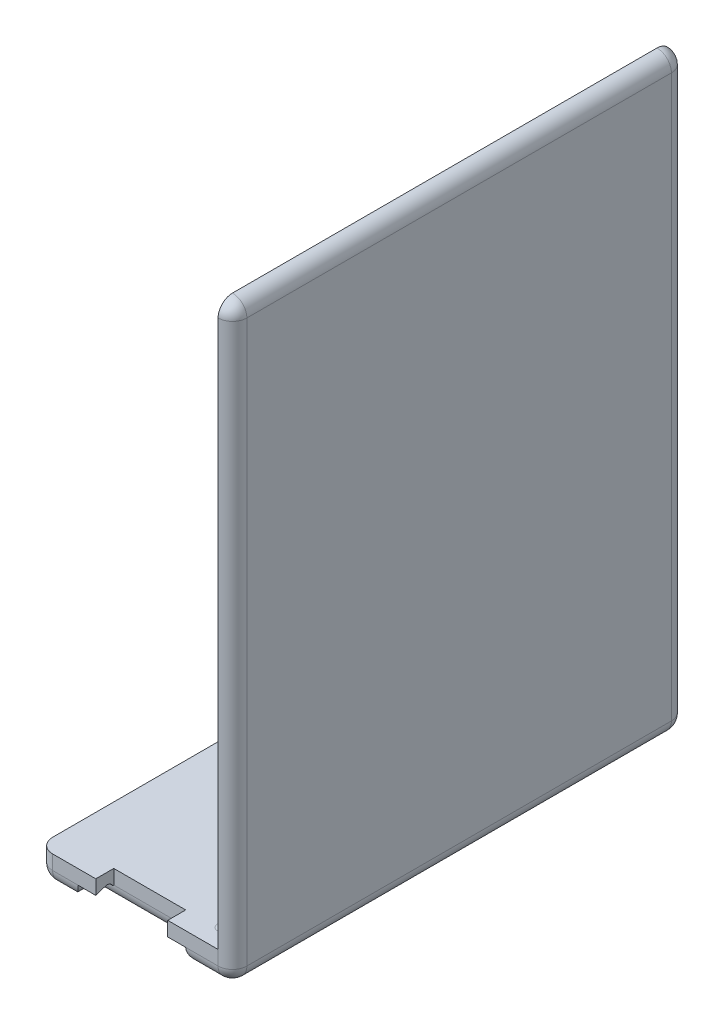
from build123d import *

# Parameters (mm, degrees)
SKETCH1_W           = 25
SKETCH1_H           = 63
BOSS_EXTRUDE1_DEPTH = 4
SKETCH3_W           = 63
SKETCH3_H           = 4
BOSS_EXTRUDE2_DEPTH = 2
SKETCH4_W           = 2
SKETCH4_H           = 63
BOSS_EXTRUDE3_DEPTH = 78
SKETCH6_W           = 10
SKETCH6_H           = 2.5
CUT_EXTRUDE1_DEPTH  = 107.386089316
SKETCH6_3_W         = 10
SKETCH6_3_H         = 2.5
CUT_EXTRUDE2_DEPTH  = 80
SKETCH8_W           = 15
SKETCH8_H           = 2
CUT_EXTRUDE3_DEPTH  = 2.5
CUT_EXTRUDE5_DEPTH  = 15
SKETCH11_W          = 15
SKETCH11_H          = 2
CUT_EXTRUDE6_DEPTH  = 3
CUT_EXTRUDE7_DEPTH  = 15
FILLET6_R           = 2
FILLET7_R           = 2
BOSS_EXTRUDE4_DEPTH = 70
FILLET8_R           = 0.4
FILLET9_R           = 2
CUT_EXTRUDE8_DEPTH  = 2


# Some blends are built 0.0001 mm under size
with BuildPart() as part:
    # Sketch1 → Boss-Extrude1 (new body)
    with BuildSketch(Plane(origin=(0, 0, 0), x_dir=(1, 0, 0), z_dir=(0, 1, 0))):
        with Locations((-12.5, -31.5)):
            Rectangle(SKETCH1_W, SKETCH1_H)
    extrude(amount=BOSS_EXTRUDE1_DEPTH)

    # Sketch3 → Boss-Extrude2 (add)
    with BuildSketch(Plane(origin=(0, 0, 0), x_dir=(0, 0, -1), z_dir=(1, 0, 0))):
        with Locations((-31.5, 2)):
            Rectangle(SKETCH3_W, SKETCH3_H)
    extrude(amount=BOSS_EXTRUDE2_DEPTH)

    # Sketch4 → Boss-Extrude3 (add)
    with BuildSketch(Plane(origin=(0, 4, 0), x_dir=(1, 0, 0), z_dir=(0, 1, 0))):
        with Locations((1, -31.5)):
            Rectangle(SKETCH4_W, SKETCH4_H)
    extrude(amount=BOSS_EXTRUDE3_DEPTH)

    # Sketch6 → Cut-Extrude1 (cut, through all)
    with BuildSketch(Plane.XZ):
        with Locations((-12, 1.25)):
            Rectangle(SKETCH6_W, SKETCH6_H)
    extrude(amount=-CUT_EXTRUDE1_DEPTH, mode=Mode.SUBTRACT)

    # Sketch6<3> → Cut-Extrude2 (cut)
    with BuildSketch(Plane.XZ):
        with Locations((-12, 61.75)):
            Rectangle(SKETCH6_3_W, SKETCH6_3_H)
    extrude(amount=-CUT_EXTRUDE2_DEPTH, mode=Mode.SUBTRACT)

    # Sketch8 → Cut-Extrude3 (cut)
    with BuildSketch(Plane.XY.offset(63)):
        with Locations((-12, 1)):
            Rectangle(SKETCH8_W, SKETCH8_H)
    extrude(amount=-CUT_EXTRUDE3_DEPTH, mode=Mode.SUBTRACT)

    # Sketch9 → Cut-Extrude5 (cut)
    with BuildSketch(Plane.ZY.offset(4.5)):
        with BuildLine():
            ThreePointArc((61.5, 2.5), (61, 2.366025404), (60.633974596, 2))
            Line((60.633974596, 2), (63, 2))
            Line((63, 2), (61.5, 2.5))
        make_face()
    extrude(amount=CUT_EXTRUDE5_DEPTH, mode=Mode.SUBTRACT)

    # Sketch11 → Cut-Extrude6 (cut)
    with BuildSketch(Plane(origin=(0, 0, 0), x_dir=(-1, 0, 0), z_dir=(0, 0, -1))):
        with Locations((12, 1)):
            Rectangle(SKETCH11_W, SKETCH11_H)
    extrude(amount=-CUT_EXTRUDE6_DEPTH, mode=Mode.SUBTRACT)

    # Sketch12 → Cut-Extrude7 (cut)
    with BuildSketch(Plane.ZY.offset(4.5)):
        with BuildLine():
            ThreePointArc((2.766025404, 2), (2.4, 2.366025404), (1.9, 2.5))
            Line((1.9, 2.5), (0, 2))
            Line((0, 2), (2.766025404, 2))
        make_face()
    extrude(amount=CUT_EXTRUDE7_DEPTH, mode=Mode.SUBTRACT)

    # Fillet6
    fillet6_edges = [part.edges().sort_by_distance(p)[0] for p in [
        (-19.5, 0, 1.5),
        (-22.25, 0, 0),
        (-25, 0, 31.5),
        (-22.25, 0, 63),
        (-19.5, 0, 61.75),
        (-12, 0, 60.5),
        (-4.5, 0, 61.75),
        (-1.25, 0, 63),
        (2, 0, 31.5),
        (-1.25, 0, 0),
        (-4.5, 0, 1.5),
        (-12, 0, 3),
    ]]
    fillet(fillet6_edges, radius=FILLET6_R - 0.0001)  # a hair under: the kernel refuses the full size

    # Fillet7
    # the kernel refuses this fillet: 2 mm, written as the material it takes off along each edge
    with BuildSketch(Plane(origin=(-23, 0, 61), x_dir=(0, 0, 1), z_dir=(1, 0, 0))) as fillet7_piece_1:
        with BuildLine():
            CenterArc((0.0001, -1.9999), 1.9999, 0, 90)
            Line((2, -1.9999), (2, 0))
            Line((2, 0), (0.0001, 0))
        make_face()
    revolve(axis=Axis((-23, 0, 61), (0, -1, 0)), revolution_arc=90, mode=Mode.SUBTRACT)
    with BuildSketch(Plane(origin=(-23, 0, 2), x_dir=(-1, 0, 0), z_dir=(0, 0, 1))) as fillet7_piece_2:
        with BuildLine():
            CenterArc((0.0001, -1.9999), 1.9999, 0, 90)
            Line((2, -1.9999), (2, 0))
            Line((2, 0), (0.0001, 0))
        make_face()
    revolve(axis=Axis((-23, 0, 2), (0, -1, 0)), revolution_arc=90, mode=Mode.SUBTRACT)
    with BuildSketch(Plane(origin=(-25, 0, 63), x_dir=(0, 0, -1), z_dir=(0, 1, 0)), Plane(origin=(-25, 0, 0), x_dir=(1, 0, 0), z_dir=(0, 1, 0))) as fillet7_piece_3:
        with BuildLine():
            CenterArc((FILLET7_R, -FILLET7_R), FILLET7_R, 90, 90)
            Line((0, -FILLET7_R), (0, 0))
            Line((0, 0), (FILLET7_R, 0))
        make_face()
    extrude(amount=9, mode=Mode.SUBTRACT)

    # Sketch13 → Boss-Extrude4 (add)
    with BuildSketch(Plane(origin=(0, 4, 0), x_dir=(1, 0, 0), z_dir=(0, 1, 0))):
        Polygon((0, -4.25), (-1.5, -4.25), (-1.5, -2.6), (-2.7, -2.6), (-2.7, -5.6), (0, -5.6), align=None)
        Polygon((-1.5, -60.4), (-2.7, -60.4), (-2.7, -57.4), (0, -57.4), (0, -58.75), (-1.5, -58.75), align=None)
    extrude(amount=BOSS_EXTRUDE4_DEPTH)

    # Fillet8
    fillet8_edges = [part.edges().sort_by_distance(p)[0] for p in [
        (0, 39, 5.6),
        (-1.5, 4, 3.425),
        (-2.1, 4, 2.6),
        (-1.5, 39, 2.6),
        (-2.7, 4, 4.1),
        (-2.7, 39, 2.6),
        (-1.35, 4, 5.6),
        (-2.7, 39, 5.6),
        (0, 74, 4.925),
        (-2.1, 74, 2.6),
        (-2.7, 74, 4.1),
        (-1.35, 74, 5.6),
        (-1.5, 4, 59.575),
        (-1.5, 39, 60.4),
        (-1.35, 4, 57.4),
        (0, 39, 57.4),
        (-2.7, 4, 58.9),
        (-2.7, 39, 57.4),
        (-2.1, 4, 60.4),
        (-2.7, 39, 60.4),
        (0, 74, 58.075),
        (-1.35, 74, 57.4),
        (-2.7, 74, 58.9),
        (-2.1, 74, 60.4),
    ]]
    fillet(fillet8_edges, radius=FILLET8_R)

    # Fillet9
    # the kernel refuses this fillet: 2 mm, written as the material it takes off along each edge
    with BuildSketch(Plane(origin=(0, 0, 61), x_dir=(1, 0, 0), z_dir=(0, 0, -1))) as fillet9_piece_1:
        with BuildLine():
            CenterArc((0.0001, -1.9999), 1.9999, 0, 90)
            Line((2, -1.9999), (2, 0))
            Line((2, 0), (0.0001, 0))
        make_face()
    revolve(axis=Axis((0, 0, 61), (0, -1, 0)), revolution_arc=90, mode=Mode.SUBTRACT)
    with BuildSketch(Plane(origin=(0, 0, 2), x_dir=(0, 0, -1), z_dir=(-1, 0, 0))) as fillet9_piece_2:
        with BuildLine():
            CenterArc((0.0001, -1.9999), 1.9999, 0, 90)
            Line((2, -1.9999), (2, 0))
            Line((2, 0), (0.0001, 0))
        make_face()
    revolve(axis=Axis((0, 0, 2), (0, -1, 0)), revolution_arc=90, mode=Mode.SUBTRACT)
    with BuildSketch(Plane(origin=(0, 80, 61), x_dir=(0, 0, 1), z_dir=(1, 0, 0))) as fillet9_piece_3_section:
        Polygon((0, 0), (FILLET9_R, 0), (FILLET9_R, -FILLET9_R), (0, -FILLET9_R), align=None)
    fillet9_piece_3 = extrude(amount=FILLET9_R, mode=Mode.PRIVATE)
    fillet9_piece_3 = fillet9_piece_3 - Plane(origin=(0, 80, 61), x_dir=(0, -0.7071067811865475, -0.7071067811865475), z_dir=(1, 0, 0)) * Sphere(FILLET9_R, mode=Mode.PRIVATE)
    add(fillet9_piece_3, mode=Mode.SUBTRACT)
    with BuildSketch(Plane(origin=(0, 80, 2), x_dir=(0, 0, -1), z_dir=(0, 1, 0))) as fillet9_piece_4_section:
        Polygon((0, 0), (FILLET9_R, 0), (FILLET9_R, -FILLET9_R), (0, -FILLET9_R), align=None)
    fillet9_piece_4 = extrude(amount=FILLET9_R, mode=Mode.PRIVATE)
    fillet9_piece_4 = fillet9_piece_4 - Plane(origin=(0, 80, 2), x_dir=(-0.7071067811865474, 0, 0.7071067811865476), z_dir=(0, 1, 0)) * Sphere(FILLET9_R, mode=Mode.PRIVATE)
    add(fillet9_piece_4, mode=Mode.SUBTRACT)
    with BuildSketch(Plane(origin=(2, 80, 63), x_dir=(-1, 0, 0), z_dir=(0, -1, 0)), Plane(origin=(2, 80, 0), x_dir=(0, 0, 1), z_dir=(0, -1, 0))) as fillet9_piece_5:
        with BuildLine():
            CenterArc((FILLET9_R, FILLET9_R), FILLET9_R, 180, 90)
            Line((0, FILLET9_R), (0, 0))
            Line((0, 0), (FILLET9_R, 0))
        make_face()
    extrude(amount=80, mode=Mode.SUBTRACT)
    with BuildSketch(Plane(origin=(2, 82, 2), x_dir=(-1, 0, 0), z_dir=(0, 0, 1))) as fillet9_piece_6:
        with BuildLine():
            CenterArc((FILLET9_R, FILLET9_R), FILLET9_R, 180, 90)
            Line((0, FILLET9_R), (0, 0))
            Line((0, 0), (FILLET9_R, 0))
        make_face()
    extrude(amount=59, mode=Mode.SUBTRACT)
    with BuildSketch(Plane(origin=(-5, 82, 0), x_dir=(0, 0, 1), z_dir=(1, 0, 0))) as fillet9_piece_7:
        with BuildLine():
            CenterArc((FILLET9_R, FILLET9_R), FILLET9_R, 180, 90)
            Line((0, FILLET9_R), (0, 0))
            Line((0, 0), (FILLET9_R, 0))
        make_face()
    extrude(amount=5, mode=Mode.SUBTRACT)
    with BuildSketch(Plane(origin=(0, 82, 63), x_dir=(0, -1, 0), z_dir=(-1, 0, 0))) as fillet9_piece_8:
        with BuildLine():
            CenterArc((FILLET9_R, -FILLET9_R), FILLET9_R, 90, 90)
            Line((0, -FILLET9_R), (0, 0))
            Line((0, 0), (FILLET9_R, 0))
        make_face()
    extrude(amount=5, mode=Mode.SUBTRACT)

    # Sketch14 → Cut-Extrude8 (cut)
    with BuildSketch(Plane(origin=(0, 0, 0), x_dir=(-1, 0, 0), z_dir=(0, -1, 0))):
        Polygon((2.475, -44.755288462), (2.475, -39.626442308), (4.184615385, -39.626442308), (4.184615385, -43.045673077), (6.016346154, -43.045673077), (6.016346154, -39.626442308), (7.725961538, -39.626442308), (7.725961538, -43.045673077), (10.290384615, -43.045673077), (10.290384615, -39.626442308), (12, -39.626442308), (12, -44.755288462), align=None)
        with BuildLine():
            Line((4.127373798, -29.36875), (5.32563101, -30.622340745))
            add(Edge.make_bspline(
                [(5.32563101, -30.622340745), (5.215656446, -30.728670621), (5.00084167, -30.936366181), (4.716760481, -31.271211004), (4.479022391, -31.618547806), (4.282817657, -31.974910665), (4.1283877, -32.340997034), (4.019188769, -32.718034679), (3.951872251, -33.105472685), (3.944228977, -33.367760679), (3.940384615, -33.499684495)],
                knots=[0, 0, 0, 0, 1.115315123, 2.178559852, 3.196385012, 4.180486591, 5.141138664, 6.08807191, 7.038351522, 8, 8, 8, 8], degree=3))
            add(Edge.make_bspline(
                [(3.940384615, -33.499684495), (3.943430773, -33.609852745), (3.949442029, -33.827257647), (3.993616664, -34.146434852), (4.068454203, -34.451860102), (4.172477839, -34.743775716), (4.303478478, -35.023624956), (4.468136835, -35.288801929), (4.66095724, -35.540731723), (4.881602279, -35.776470747), (5.124457022, -35.989292092), (5.3802266, -36.181047148), (5.653434959, -36.339876529), (5.940097883, -36.469528773), (6.240318887, -36.571697722), (6.554082943, -36.644211125), (6.882098475, -36.686225439), (7.105089084, -36.692489498), (7.218419471, -36.695673077)],
                knots=[0, 0, 0, 0, 1.035268443, 2.04298821, 3.02163646, 3.985902049, 4.951223231, 5.920091634, 6.913651787, 7.92868536, 8.949353712, 9.945284791, 10.92850487, 11.913014323, 12.897904816, 13.904240668, 14.934873455, 16, 16, 16, 16], degree=3))
            add(Edge.make_bspline(
                [(7.218419471, -36.695673077), (7.297959929, -36.694741338), (7.454735806, -36.692904862), (7.686061943, -36.673349959), (7.910961475, -36.640784545), (8.128893881, -36.595420698), (8.340143725, -36.537268007), (8.545205669, -36.470091627), (8.741634762, -36.384290241), (8.933108884, -36.289909849), (9.11501886, -36.18132817), (9.287484456, -36.062430899), (9.450544274, -35.934313792), (9.603618532, -35.79526583), (9.744503621, -35.643536098), (9.877035647, -35.482789098), (9.999124059, -35.311427935), (10.108824685, -35.129383928), (10.211077297, -34.942165927), (10.295752297, -34.745917018), (10.37187103, -34.546126649), (10.429134997, -34.339288345), (10.478942609, -34.129045949), (10.509361654, -33.912472973), (10.53247611, -33.691624806), (10.533899223, -33.542361942), (10.534615385, -33.467247596)],
                knots=[0, 0, 0, 0, 1.103738238, 2.175490744, 3.219137561, 4.256155604, 5.262629953, 6.259184223, 7.247888397, 8.234817694, 9.220364322, 10.185094651, 11.140491148, 12.096499151, 13.05201798, 14.011605636, 14.986460005, 15.968997565, 16.960259839, 17.944382265, 18.933125845, 19.924977513, 20.920749559, 21.929466621, 22.958034467, 24, 24, 24, 24], degree=3))
            add(Edge.make_bspline(
                [(10.534615385, -33.467247596), (10.530944039, -33.339836579), (10.5237308, -33.089507064), (10.466912436, -32.72220012), (10.3744443, -32.371628915), (10.262094631, -32.092536119), (10.153155695, -31.87374912), (10.055224457, -31.705792913), (9.942325335, -31.533955689), (9.813989523, -31.358499144), (9.670777787, -31.178404897), (9.509891818, -30.996653263), (9.336531919, -30.808649608), (9.212805709, -30.685487988), (9.14936899, -30.622340745)],
                knots=[0, 0, 0, 0, 1.404693586, 2.759857621, 4.088769373, 5.395275838, 6.0697462, 6.783214465, 7.53810233, 8.336454657, 9.18000028, 10.074808326, 11.012918585, 12, 12, 12, 12], degree=3))
            Line((9.14936899, -30.622340745), (10.42585637, -29.406911058))
            add(Edge.make_bspline(
                [(10.42585637, -29.406911058), (10.508344236, -29.492349223), (10.66934291, -29.659106249), (10.897946003, -29.910654594), (11.103371295, -30.161886355), (11.293074824, -30.406732297), (11.461530064, -30.649203251), (11.608905255, -30.889273504), (11.738927729, -31.124225355), (11.849404719, -31.358937656), (11.943211157, -31.594870906), (12.023972344, -31.837618495), (12.092293402, -32.087922525), (12.147419524, -32.347311737), (12.191623231, -32.613366709), (12.221460478, -32.88857736), (12.241519066, -33.17119872), (12.243321497, -33.362905167), (12.244230769, -33.459615385)],
                knots=[0, 0, 0, 0, 1.244526981, 2.429050516, 3.560637417, 4.644440555, 5.67424972, 6.652764056, 7.595344123, 8.486817594, 9.369275933, 10.254498637, 11.166417451, 12.086725134, 13.032340136, 13.991389299, 14.986715468, 16, 16, 16, 16], degree=3))
            add(Edge.make_bspline(
                [(12.244230769, -33.459615385), (12.239702252, -33.637260074), (12.230841202, -33.984861353), (12.165186822, -34.494261963), (12.055118412, -34.978178869), (11.89945132, -35.43778935), (11.700593905, -35.872947259), (11.456804052, -36.283541272), (11.168729472, -36.6689096), (10.839746679, -37.025939228), (10.476412802, -37.348889518), (10.086291896, -37.634340174), (9.667466658, -37.870464968), (9.226124476, -38.066524473), (8.760251333, -38.219840426), (8.269343298, -38.327748867), (7.753874371, -38.394295214), (7.401797212, -38.401575479), (7.222235577, -38.405288462)],
                knots=[0, 0, 0, 0, 1.078019885, 2.10938526, 3.111377082, 4.085535484, 5.04941344, 6.010039228, 6.978205633, 7.964457913, 8.951525778, 9.924444315, 10.892603023, 11.863865945, 12.85144698, 13.863884204, 14.910567087, 16, 16, 16, 16], degree=3))
            add(Edge.make_bspline(
                [(7.222235577, -38.405288462), (7.105124199, -38.403735), (6.873038071, -38.400656419), (6.530578319, -38.367693594), (6.197159621, -38.322921355), (5.87563116, -38.24937388), (5.562333097, -38.163871687), (5.260037936, -38.053714796), (4.967472298, -37.925734307), (4.685005689, -37.779604347), (4.415688374, -37.612234457), (4.157802826, -37.430013131), (3.914689677, -37.228521024), (3.685346603, -37.009797495), (3.467175899, -36.775863727), (3.265543106, -36.5227133), (3.075038893, -36.254663597), (2.901344841, -35.969857791), (2.743373088, -35.674785742), (2.60746578, -35.370881242), (2.490852332, -35.062062094), (2.39484405, -34.747391914), (2.322984951, -34.426314296), (2.268642816, -34.100980666), (2.23825374, -33.768660491), (2.233279961, -33.54553493), (2.230769231, -33.432902644)],
                knots=[0, 0, 0, 0, 1.071814294, 2.12407397, 3.147667899, 4.14936388, 5.141177959, 6.119239245, 7.091825145, 8.063277363, 9.028022524, 9.992609517, 10.952139039, 11.915934802, 12.892469547, 13.878248468, 14.87668965, 15.901326483, 16.93027266, 17.938917451, 18.9468897, 19.950817235, 20.948103127, 21.957084021, 22.968749718, 24, 24, 24, 24], degree=3))
            add(Edge.make_bspline(
                [(2.230769231, -33.432902644), (2.232209936, -33.336816296), (2.235076367, -33.14564263), (2.258928958, -32.860945114), (2.29649557, -32.578555641), (2.352779515, -32.299336541), (2.420941964, -32.022032179), (2.5048997, -31.747803556), (2.607308461, -31.477406865), (2.720594162, -31.208497981), (2.849564051, -30.946439891), (2.99392057, -30.693510058), (3.149887215, -30.449081766), (3.320146636, -30.214628512), (3.502197945, -29.988498941), (3.696035114, -29.770934329), (3.905174301, -29.564022372), (4.052932862, -29.434169852), (4.127373798, -29.36875)],
                knots=[0, 0, 0, 0, 0.996333415, 1.982307736, 2.96084097, 3.949129141, 4.93457382, 5.921430247, 6.92116383, 7.931890485, 8.946633814, 9.948019707, 10.950686436, 11.952094051, 12.951305284, 13.960287133, 14.972390273, 16, 16, 16, 16], degree=3))
        make_face()
        with BuildLine():
            Line((3.98999399, -18.929792668), (5.228320312, -20.223452524))
            add(Edge.make_bspline(
                [(5.228320312, -20.223452524), (5.125776286, -20.325873832), (4.924567975, -20.526841348), (4.662681532, -20.85549858), (4.440026282, -21.195887727), (4.256943561, -21.549129148), (4.114928686, -21.915714909), (4.013340901, -22.29492158), (3.953087465, -22.687366081), (3.944652189, -22.953033491), (3.940384615, -23.087439904)],
                knots=[0, 0, 0, 0, 1.075575784, 2.110457258, 3.113929901, 4.09197124, 5.059417775, 6.02750972, 7.002078037, 8, 8, 8, 8], degree=3))
            add(Edge.make_bspline(
                [(3.940384615, -23.087439904), (3.943374885, -23.203966155), (3.94924654, -23.432775663), (3.993835496, -23.768989195), (4.068319334, -24.090261834), (4.17150428, -24.398111338), (4.305780414, -24.690658423), (4.469075756, -24.96959725), (4.66263795, -25.233214677), (4.882803718, -25.479421772), (5.123162257, -25.703632096), (5.380495941, -25.899243132), (5.650200477, -26.066657055), (5.933784958, -26.202334567), (6.229162036, -26.308161621), (6.537532098, -26.38215904), (6.858234137, -26.429587219), (7.077055288, -26.435158735), (7.187890625, -26.437980769)],
                knots=[0, 0, 0, 0, 1.07501736, 2.110890821, 3.123068569, 4.114115229, 5.101558292, 6.087971832, 7.091606401, 8.114127012, 9.131531654, 10.119863779, 11.092210096, 12.055570724, 13.015277632, 13.98177939, 14.977748899, 16, 16, 16, 16], degree=3))
            add(Edge.make_bspline(
                [(7.187890625, -26.437980769), (7.302559057, -26.435341311), (7.528471565, -26.430141218), (7.86000789, -26.38018845), (8.178969694, -26.303227595), (8.482990501, -26.190577477), (8.776234425, -26.051939107), (9.053023109, -25.876123544), (9.317575484, -25.671102245), (9.565315976, -25.437254509), (9.793583316, -25.182849095), (9.990816731, -24.907464092), (10.15992885, -24.618594246), (10.298093048, -24.314416937), (10.402463754, -23.9953235), (10.479617793, -23.662858403), (10.526084809, -23.315178344), (10.531743553, -23.078040532), (10.534615385, -22.957692308)],
                knots=[0, 0, 0, 0, 1.022033888, 2.013546672, 2.983454993, 3.943493592, 4.899972998, 5.871025147, 6.861547676, 7.880838944, 8.905404004, 9.905061033, 10.896427776, 11.886495431, 12.878446209, 13.885654703, 14.926962766, 16, 16, 16, 16], degree=3))
            add(Edge.make_bspline(
                [(10.534615385, -22.957692308), (10.533909018, -22.87940574), (10.532522265, -22.725711788), (10.510011348, -22.500268951), (10.477829376, -22.284348863), (10.435224267, -22.077115325), (10.374930392, -21.880660838), (10.30442413, -21.692265356), (10.221212683, -21.513032711), (10.1224251, -21.343934684), (10.011696295, -21.182454605), (9.884998995, -21.030103958), (9.745189758, -20.884210336), (9.590560618, -20.746478485), (9.419729005, -20.619239558), (9.23583418, -20.498417142), (9.037051098, -20.385394633), (8.896680554, -20.318612614), (8.825, -20.284510216)],
                knots=[0, 0, 0, 0, 1.109579412, 2.178351274, 3.208885622, 4.204702371, 5.174744997, 6.119429583, 7.05542196, 7.97267548, 8.893247984, 9.828544973, 10.778894627, 11.756245826, 12.760884819, 13.796418446, 14.874735809, 16, 16, 16, 16], degree=3))
            Line((8.825, -20.284510216), (8.825, -23.01875))
            Line((8.825, -23.01875), (7.115384615, -23.01875))
            Line((7.115384615, -23.01875), (7.115384615, -18.26960637))
            Line((7.115384615, -18.26960637), (7.52179988, -18.25625))
            add(Edge.make_bspline(
                [(7.52179988, -18.25625), (7.626177632, -18.257966194), (7.834746864, -18.26139552), (8.145270921, -18.292735959), (8.451676516, -18.344650923), (8.753655922, -18.415623632), (9.052690386, -18.504570449), (9.345916669, -18.618005263), (9.635322328, -18.750837555), (9.919681432, -18.899663633), (10.19252055, -19.066912811), (10.450903665, -19.246939759), (10.69419405, -19.437365881), (10.919364071, -19.641348685), (11.126165453, -19.858443786), (11.317204086, -20.086029466), (11.494147584, -20.324184869), (11.65013288, -20.577128393), (11.789204926, -20.840608809), (11.912847626, -21.114611588), (12.014984322, -21.400740673), (12.099400754, -21.69771336), (12.164336118, -22.005669658), (12.208912749, -22.324484053), (12.23918925, -22.654368132), (12.242529946, -22.878120139), (12.244230769, -22.99203726)],
                knots=[0, 0, 0, 0, 1.006947556, 2.012098127, 3.007912615, 4.003802745, 5.003693661, 6.015789779, 7.034654729, 8.075083123, 9.110776623, 10.12033905, 11.112364132, 12.089932562, 13.049221985, 14.003156825, 14.955669239, 15.909347409, 16.867458246, 17.828943829, 18.807340259, 19.796171017, 20.806031855, 21.841452577, 22.901035528, 24, 24, 24, 24], degree=3))
            add(Edge.make_bspline(
                [(12.244230769, -22.99203726), (12.242530783, -23.113574622), (12.239160904, -23.354497924), (12.208283983, -23.710815862), (12.155744699, -24.056357436), (12.088528746, -24.392957003), (11.995983704, -24.718167756), (11.885705845, -25.034767744), (11.753092185, -25.340186853), (11.603244095, -25.635935565), (11.433200961, -25.918118456), (11.246061244, -26.186133897), (11.040590101, -26.438510844), (10.820235369, -26.677836625), (10.579578463, -26.898518937), (10.326420992, -27.108782496), (10.051477355, -27.298438482), (9.763663746, -27.475650191), (9.463091673, -27.633061557), (9.15535396, -27.770811809), (8.842680264, -27.887734659), (8.522939821, -27.981395801), (8.198016541, -28.055592754), (7.866748868, -28.109753429), (7.53000052, -28.140053499), (7.303702723, -28.145070774), (7.189798678, -28.147596154)],
                knots=[0, 0, 0, 0, 1.08412885, 2.149066736, 3.187446822, 4.201211187, 5.20898726, 6.20137506, 7.190057482, 8.177191892, 9.15710824, 10.126769281, 11.090919562, 12.058536462, 13.026153363, 14.001871638, 14.991985849, 16.003078977, 17.015762975, 18.016485971, 19.009327865, 19.991410284, 20.986600416, 21.980997625, 22.983761488, 24, 24, 24, 24], degree=3))
            add(Edge.make_bspline(
                [(7.189798678, -28.147596154), (7.034405024, -28.144228043), (6.72754863, -28.137577022), (6.275591013, -28.075743341), (5.838788007, -27.980028913), (5.418348483, -27.840616587), (5.012577458, -27.664864832), (4.621831972, -27.450396892), (4.246613771, -27.195435065), (4.014333041, -26.997985607), (3.896499399, -26.897821514)],
                knots=[0, 0, 0, 0, 1.034063014, 2.041967874, 3.031271063, 4.007437694, 4.986016733, 5.971461028, 6.970942901, 8, 8, 8, 8], degree=3))
            add(Edge.make_bspline(
                [(3.896499399, -26.897821514), (3.828327394, -26.83563494), (3.693006989, -26.712195526), (3.504976533, -26.514877847), (3.328220947, -26.312556136), (3.166488225, -26.102428205), (3.016237957, -25.885598659), (2.880286706, -25.661443423), (2.754305712, -25.431138364), (2.644728041, -25.192887382), (2.546482518, -24.947937753), (2.463352992, -24.695204633), (2.38971999, -24.436580943), (2.333704162, -24.16977656), (2.287058454, -23.897486846), (2.255794058, -23.617778996), (2.232879482, -23.331415233), (2.231478212, -23.137733186), (2.230769231, -23.039738582)],
                knots=[0, 0, 0, 0, 1.020590567, 2.025856924, 3.013483481, 3.991664875, 4.957826714, 5.930500614, 6.890802512, 7.860442893, 8.829981142, 9.809047939, 10.802672283, 11.803273349, 12.823572789, 13.857849586, 14.916166035, 16, 16, 16, 16], degree=3))
            add(Edge.make_bspline(
                [(2.230769231, -23.039738582), (2.232348973, -22.937302405), (2.235492079, -22.733492028), (2.257240326, -22.430459748), (2.290792743, -22.131638304), (2.341123286, -21.838286961), (2.403191321, -21.549421228), (2.482715836, -21.266536344), (2.57307001, -20.987786836), (2.645107032, -20.806321962), (2.681069712, -20.715730168)],
                knots=[0, 0, 0, 0, 1.03180557, 2.052914215, 3.058998889, 4.059601663, 5.049854447, 6.033765722, 7.018406786, 8, 8, 8, 8], degree=3))
            add(Edge.make_bspline(
                [(2.681069712, -20.715730168), (2.714294569, -20.639500458), (2.781873009, -20.484451337), (2.905727948, -20.259022384), (3.042334793, -20.032112213), (3.200629648, -19.8098721), (3.371628832, -19.585866862), (3.561267133, -19.364667212), (3.767799283, -19.144613396), (3.914969895, -19.002326938), (3.98999399, -18.929792668)],
                knots=[0, 0, 0, 0, 0.894422958, 1.819231551, 2.765348375, 3.743239639, 4.753552307, 5.797344382, 6.877138289, 8, 8, 8, 8], degree=3))
        make_face()
    extrude(amount=-CUT_EXTRUDE8_DEPTH, mode=Mode.SUBTRACT)


solid = part.part
